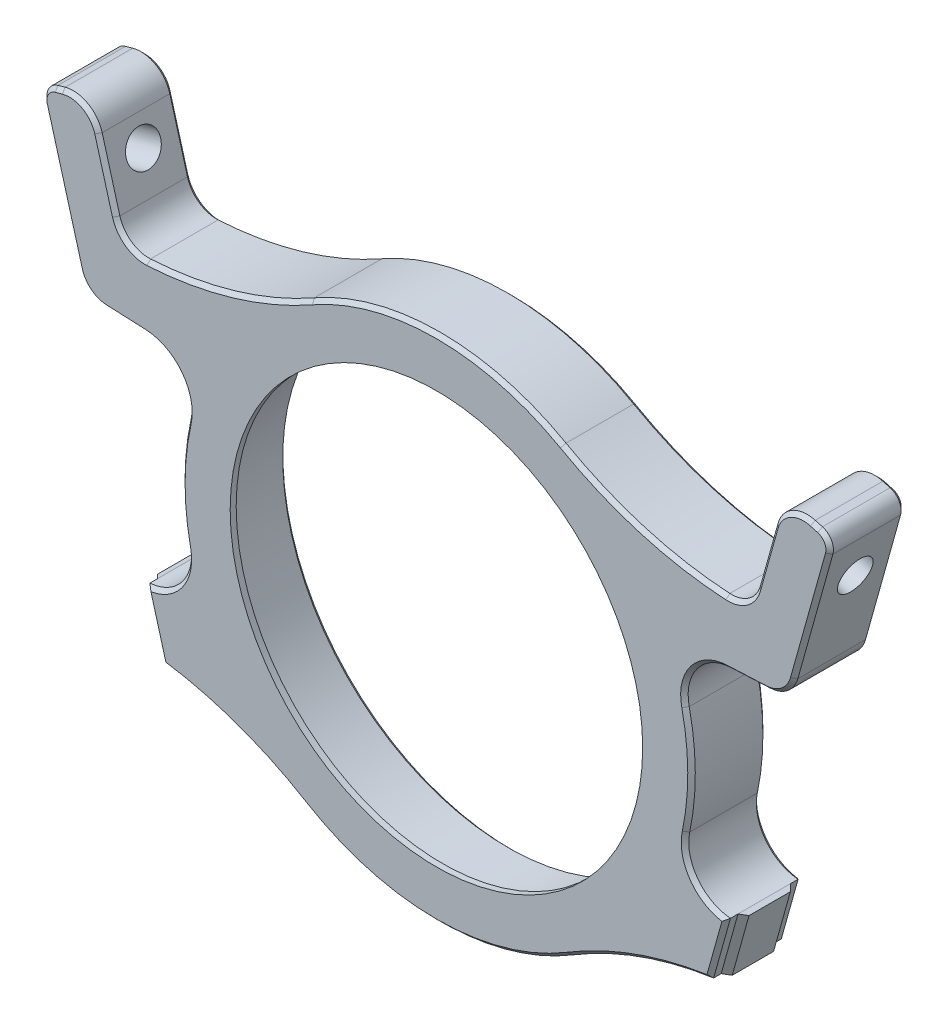
from build123d import *

# Parameters (mm, degrees)
SKIZZE1_R                       = 29.95
AUFSATZ_LINEAR_AUSTRAGEN1_DEPTH = 10
SKIZZE2_R                       = 32.75
SKIZZE2_R_2                     = 27.45
AUFSATZ_LINEAR_AUSTRAGEN2_DEPTH = 0.8
SKIZZE5_R                       = 2.3
SCHNITT_LINEAR_AUSTRAGEN1_DEPTH = 10
VERRUNDUNG1_R                   = 50
VERRUNDUNG2_R                   = 6
VERRUNDUNG3_R                   = 4
AUFSATZ_LINEAR_AUSTRAGEN3_DEPTH = 8.306468
FILLET1_R                       = 2
CHAMFER1_SIZE                   = 0.5


with BuildPart() as part:
    # Skizze1 → Aufsatz-Linear austragen1 (new body)
    with BuildSketch(Plane.XY):
        with BuildLine():
            Line((-25.605118216, -22.29305769), (-36.396367746, -22.29305769))
            Line((-36.396367746, -22.29305769), (-38.631857121, -14.29305769))
            Line((-38.631857121, -14.29305769), (-30.794658658, -14.29305769))
            ThreePointArc((-30.794658658, -14.29305769), (-33.95, 0), (-30.794658658, 14.29305769))
            Line((-30.794658658, 14.29305769), (-46.822915195, 15.019747505))
            Line((-46.822915195, 15.019747505), (-49.03277701, 22.928035825))
            Line((-49.03277701, 22.928035825), (-52.800545787, 36.411504164))
            Line((-52.800545787, 36.411504164), (-46.058811618, 38.295388553))
            Line((-46.058811618, 38.295388553), (-41.792257863, 23.026950955))
            Line((-41.792257863, 23.026950955), (-25.605118216, 22.29305769))
            ThreePointArc((-25.605118216, 22.29305769), (0, 33.95), (25.605118216, 22.29305769))
            Line((25.605118216, 22.29305769), (41.792257863, 23.026950955))
            Line((41.792257863, 23.026950955), (46.058811618, 38.295388553))
            Line((46.058811618, 38.295388553), (52.800545787, 36.411504164))
            Line((52.800545787, 36.411504164), (49.03277701, 22.928035825))
            Line((49.03277701, 22.928035825), (46.822915195, 15.019747505))
            Line((46.822915195, 15.019747505), (30.794658658, 14.29305769))
            ThreePointArc((30.794658658, 14.29305769), (33.95, 0), (30.794658658, -14.29305769))
            Line((30.794658658, -14.29305769), (38.631857121, -14.29305769))
            Line((38.631857121, -14.29305769), (36.396367746, -22.29305769))
            Line((36.396367746, -22.29305769), (25.605118216, -22.29305769))
            ThreePointArc((25.605118216, -22.29305769), (0, -33.95), (-25.605118216, -22.29305769))
        make_face()
        Circle(SKIZZE1_R, mode=Mode.SUBTRACT)
    extrude(amount=AUFSATZ_LINEAR_AUSTRAGEN1_DEPTH)

    # Skizze2 → Aufsatz-Linear austragen2 (add)
    with BuildSketch(Plane.XY.offset(10)):
        Circle(SKIZZE2_R)
        Circle(SKIZZE2_R_2, mode=Mode.SUBTRACT)
    extrude(amount=-AUFSATZ_LINEAR_AUSTRAGEN2_DEPTH)

    # Skizze5 → Schnitt-Linear austragen1 (cut)
    with BuildSketch(Plane(origin=(32.796772797, -9.164604643, 0), x_dir=(0, 0, 1), z_dir=(-0.9631048813334842, 0.2691263412444341, 0))):
        with Locations(Location((5, 41.61405755, 0), (0, 0, 270))):
            Circle(SKIZZE5_R)
    schnitt_linear_austragen1 = extrude(amount=-SCHNITT_LINEAR_AUSTRAGEN1_DEPTH, mode=Mode.SUBTRACT)

    # Spiegeln1: Schnitt-Linear austragen1 across plane
    add(schnitt_linear_austragen1.mirror(Plane(origin=(0, 0, 0), x_dir=(0, 0, 1), z_dir=(1, 0, 0))), mode=Mode.SUBTRACT)

    # Verrundung1
    # the kernel refuses this fillet: 50 mm, written as the material it adds along each edge
    with BuildSketch(Plane(origin=(-25.605118216, 22.29305769, 0), x_dir=(-0.9989738125947814, 0.045291519623947715, 0), z_dir=(0, 0, 1))) as verrundung1_piece_1:
        with BuildLine():
            CenterArc((18.087510266, -49.964502541), VERRUNDUNG1_R, 92.159120897, 29.993366161)
            Line((-8.521208788, -7.632764208), (-9.053383169, -6.786129441))
            ThreePointArc((-9.053383169, -6.786129441), (-4.604005024, -3.433010053), (-0.783167276, 0.621811079))
            Line((-0.783167276, 0.621811079), (0, 1))
            ThreePointArc((0, 1), (8.101883875, 1), (16.1660929, 0.999290051))
            Line((16.1660929, 0.999290051), (16.20376775, 0))
        make_face()
    extrude(amount=10)
    with BuildSketch(Plane(origin=(25.605118216, 22.29305769, 0), x_dir=(-0.7743254156963487, 0.6327876030760059, 0), z_dir=(0, 0, 1))) as verrundung1_piece_2:
        with BuildLine():
            CenterArc((19.863886687, -49.285246753), VERRUNDUNG1_R, 99.699501479, 29.993366161)
            Line((-12.069715077, -10.811293506), (-12.708387112, -10.041814441))
            ThreePointArc((-12.708387112, -10.041814441), (-6.702066157, -4.660775852), (-0.667208619, 0.744870901))
            Line((-0.667208619, 0.744870901), (0.168480803, 0.985704935))
            ThreePointArc((0.168480803, 0.985704935), (5.719923266, 0.514682545), (11.271365728, 0.985704935))
            Line((11.271365728, 0.985704935), (11.439846531, 0))
        make_face()
    extrude(amount=10)
    with BuildSketch(Plane(origin=(-25.605118216, -22.29305769, 0), x_dir=(-1, 0, 0), z_dir=(0, 0, 1))) as verrundung1_piece_3:
        with BuildLine():
            CenterArc((17.927143088, 49.488170537), VERRUNDUNG1_R, 238.764970405, 23.029881184)
            Line((-8.000350244, 6.735801135), (-8.51890011, 5.880753747))
            ThreePointArc((-8.51890011, 5.880753747), (-4.38330809, 2.912839933), (-0.754200831, -0.65664382))
            Line((-0.754200831, -0.65664382), (0, -1))
            ThreePointArc((0, -1), (5.395624765, -1), (10.648531659, -0.989763411))
            Line((10.648531659, -0.989763411), (10.79124953, 0))
        make_face()
    extrude(amount=10)
    with BuildSketch(Plane(origin=(25.605118216, -22.29305769, 0), x_dir=(-0.7649741312009661, -0.6440610053351523, 0), z_dir=(0, 0, 1))) as verrundung1_piece_4:
        with BuildLine():
            CenterArc((18.15960016, 49.403344062), VERRUNDUNG1_R, 238.109839077, 23.029881184)
            Line((-8.255026734, 6.950223021), (-8.783319272, 6.1011606))
            ThreePointArc((-8.783319272, 6.1011606), (-4.771574372, 2.710137379), (-0.644061005, -0.764974131))
            Line((-0.644061005, -0.764974131), (0.154025447, -0.988066881))
            ThreePointArc((0.154025447, -0.988066881), (5.229163914, -0.594870618), (10.304302381, -0.988066881))
            Line((10.304302381, -0.988066881), (10.458327827, 0))
        make_face()
    extrude(amount=10)

    # Verrundung2
    # the kernel refuses this fillet: 6 mm, written as the material it adds along each edge
    with BuildSketch(Plane(origin=(-30.794658658, -14.29305769, 0), x_dir=(-0.31650196905899364, 0.9485918530020063, 0), z_dir=(0, 0, 1))) as verrundung2_piece_1_section:
        with BuildLine():
            CenterArc((8.297060958, 5.962063603), VERRUNDUNG2_R, 165.796112126, 97.757459861)
            Line((2.480488745, 7.434302612), (2.364157301, 7.463747393))
            ThreePointArc((2.364157301, 7.463747393), (1.12641335, 3.755131543), (-0.113831022, 0.037980236))
            Line((-0.113831022, 0.037980236), (0.0134729, -0.119241272))
            ThreePointArc((0.0134729, -0.119241272), (3.811707977, 0.094656778), (7.609943054, -0.119241272))
            Line((7.609943054, -0.119241272), (7.623415954, 0))
        make_face()
    verrundung2_piece_1 = extrude(amount=10, mode=Mode.PRIVATE)
    verrundung2_piece_1 = split(verrundung2_piece_1, bisect_by=Plane(origin=(-38.694932937, -14.067332385, 5), z_dir=(0.9631048813334845, 0.2691263412444326, 0)), keep=Keep.TOP, mode=Mode.PRIVATE)
    add(verrundung2_piece_1)
    with BuildSketch(Plane(origin=(30.794658658, -14.29305769, 0), x_dir=(1, 0, 0), z_dir=(0, 0, 1))) as verrundung2_piece_2_section:
        with BuildLine():
            CenterArc((8.281601092, 5.983519558), VERRUNDUNG2_R, 167.994917884, 97.757459861)
            Line((2.412826161, 7.231510266), (2.295450662, 7.256470081))
            ThreePointArc((2.295450662, 7.256470081), (1.296203729, 3.585796077), (-0.1088471, 0.050520381))
            Line((-0.1088471, 0.050520381), (0, -0.12))
            ThreePointArc((0, -0.12), (3.918599232, -0.12), (7.828310411, -0.119670391))
            Line((7.828310411, -0.119670391), (7.837198463, 0))
        make_face()
    verrundung2_piece_2 = extrude(amount=10, mode=Mode.PRIVATE)
    verrundung2_piece_2 = split(verrundung2_piece_2, bisect_by=Plane(origin=(38.694932937, -14.067332385, 5), z_dir=(-0.9631048813334845, 0.2691263412444326, 0)), keep=Keep.TOP, mode=Mode.PRIVATE)
    add(verrundung2_piece_2)
    with BuildSketch(Plane(origin=(30.794658658, 14.29305769, 0), x_dir=(0.320743613458383, -0.9471660543039216, 0), z_dir=(0, 0, 1))) as verrundung2_piece_3:
        with BuildLine():
            CenterArc((7.9683768, 5.965018375), VERRUNDUNG2_R, 163.887999515, 99.921963772)
            Line((2.204050499, 7.630113658), (2.088763973, 7.663415564))
            Line((2.088763973, 7.663415564), (-0.115286526, 0.033301906))
            Line((-0.115286526, 0.033301906), (0.012939177, -0.119300368))
            ThreePointArc((0.012939177, -0.119300368), (3.660708963, 0.077937694), (7.308478748, -0.119300368))
            Line((7.308478748, -0.119300368), (7.321417925, 0))
        make_face()
    extrude(amount=10)
    with BuildSketch(Plane(origin=(-30.794658658, 14.29305769, 0), x_dir=(-0.9989738125947842, 0.045291519623885015, 0), z_dir=(0, 0, 1))) as verrundung2_piece_4:
        with BuildLine():
            CenterArc((7.942069821, 6), VERRUNDUNG2_R, 170.078036228, 99.921963772)
            Line((2.031809742, 7.033840317), (1.91360454, 7.054517124))
            ThreePointArc((1.91360454, 7.054517124), (1.090781254, 3.495291211), (-0.111023547, 0.045538687))
            Line((-0.111023547, 0.045538687), (0, -0.12))
            Line((0, -0.12), (7.942069821, -0.12))
            Line((7.942069821, -0.12), (7.942069821, 0))
        make_face()
    extrude(amount=10)

    # Verrundung3
    verrundung3_edges = [part.edges().sort_by_distance(p)[0] for p in [
        (41.792257863, 23.026950955, 5),
        (46.058811618, 38.295388553, 5),
        (46.822915195, 15.019747505, 5),
        (-46.822915195, 15.019747505, 5),
        (-46.058811618, 38.295388553, 5),
        (-41.792257863, 23.026950955, 5),
    ]]
    fillet(verrundung3_edges, radius=VERRUNDUNG3_R)

    # Skizze6 → Aufsatz-Linear austragen3 (add)
    with BuildSketch(Plane(origin=(3.142139221, -11.244568658, 0), x_dir=(0, 0, -1), z_dir=(-0.26912634124443263, 0.9631048813334845, 0))):
        Polygon((-8.5, 41.05316849), (-7.75, 41.80316849), (-2.25, 41.80316849), (-1.5, 41.05316849), align=None)
    aufsatz_linear_austragen3 = extrude(amount=AUFSATZ_LINEAR_AUSTRAGEN3_DEPTH)

    # Mirror1: Aufsatz-Linear austragen3 across plane
    add(aufsatz_linear_austragen3.mirror(Plane(origin=(0, 0, 0), x_dir=(0, 0, 1), z_dir=(1, 0, 0))))

    # Fillet1
    fillet1_edges = [part.edges().sort_by_distance(p)[0] for p in [
        (52.800545787, 36.411504164, 5),
        (-52.800545787, 36.411504164, 5),
    ]]
    fillet(fillet1_edges, radius=FILLET1_R)

    # Chamfer1
    chamfer1_edges = [part.edges().sort_by_distance(p)[0] for p in [
        (-33.949660085, 0.151921409, 0),
        (-33.949660085, 0.151921409, 10),
        (33.949660085, 0.151921409, 0),
        (33.949660085, 0.151921409, 10),
        (41.329691449, 14.77069548, 0),
        (41.329691449, 14.77069548, 10),
        (-34.27649539, -11.909852297, 0),
        (-34.27649539, -11.909852297, 10),
        (34.27649539, -11.909852297, 0),
        (34.27649539, -11.909852297, 10),
        (34.236583606, 12.306764188, 0),
        (34.236583606, 12.306764188, 10),
        (-34.236583606, 12.306764188, 0),
        (-34.236583606, 12.306764188, 10),
        (-41.329691449, 14.77069548, 0),
        (-41.329691449, 14.77069548, 10),
        (43.806086505, 30.233708145, 0),
        (49.932175512, 26.146654573, 0),
        (-50.392783584, 37.084320017, 0),
        (-43.806086505, 30.233708145, 0),
        (-27.277805641, 25.064576342, 0),
        (-46.871858051, 36.851739876, 0),
        (46.871858051, 36.851739876, 0),
        (46.239249313, 15.753731476, 0),
        (-46.239249313, 15.753731476, 0),
        (43.806086505, 30.233708145, 10),
        (27.277805641, 25.064576342, 10),
        (-43.806086505, 30.233708145, 10),
        (-50.392783584, 37.084320017, 10),
        (49.932175512, 26.146654573, 10),
        (-46.871858051, 36.851739876, 10),
        (46.871858051, 36.851739876, 10),
        (46.239249313, 15.753731476, 10),
        (-46.239249313, 15.753731476, 10),
        (41.103257504, 23.846631411, 0),
        (41.103257504, 23.846631411, 10),
        (-41.103257504, 23.846631411, 0),
        (-41.103257504, 23.846631411, 10),
        (-49.932175512, 26.146654573, 0),
        (-49.932175512, 26.146654573, 10),
        (50.392783584, 37.084320017, 0),
        (52.078721449, 36.004980947, 0),
        (-52.078721449, 36.004980947, 0),
        (50.392783584, 37.084320017, 10),
        (52.078721449, 36.004980947, 10),
        (-52.078721449, 36.004980947, 10),
        (37.514112433, -18.29305769, 0),
        (-37.514112433, -18.29305769, 0),
        (-37.514112433, -18.29305769, 10),
        (37.514112433, -18.29305769, 10),
        (-29.95, 0, 0),
        (0, -33.95, 0),
        (0, -33.95, 10),
        (0, 33.95, 0),
        (0, 33.95, 10),
        (-26.660994535, -24.713613484, 0),
        (-26.660994535, -24.713613484, 10),
        (26.660994535, -24.713613484, 0),
        (26.660994535, -24.713613484, 10),
        (-27.277805641, 25.064576342, 10),
        (27.277805641, 25.064576342, 0),
    ]]
    chamfer(chamfer1_edges, length=CHAMFER1_SIZE)


solid = part.part
